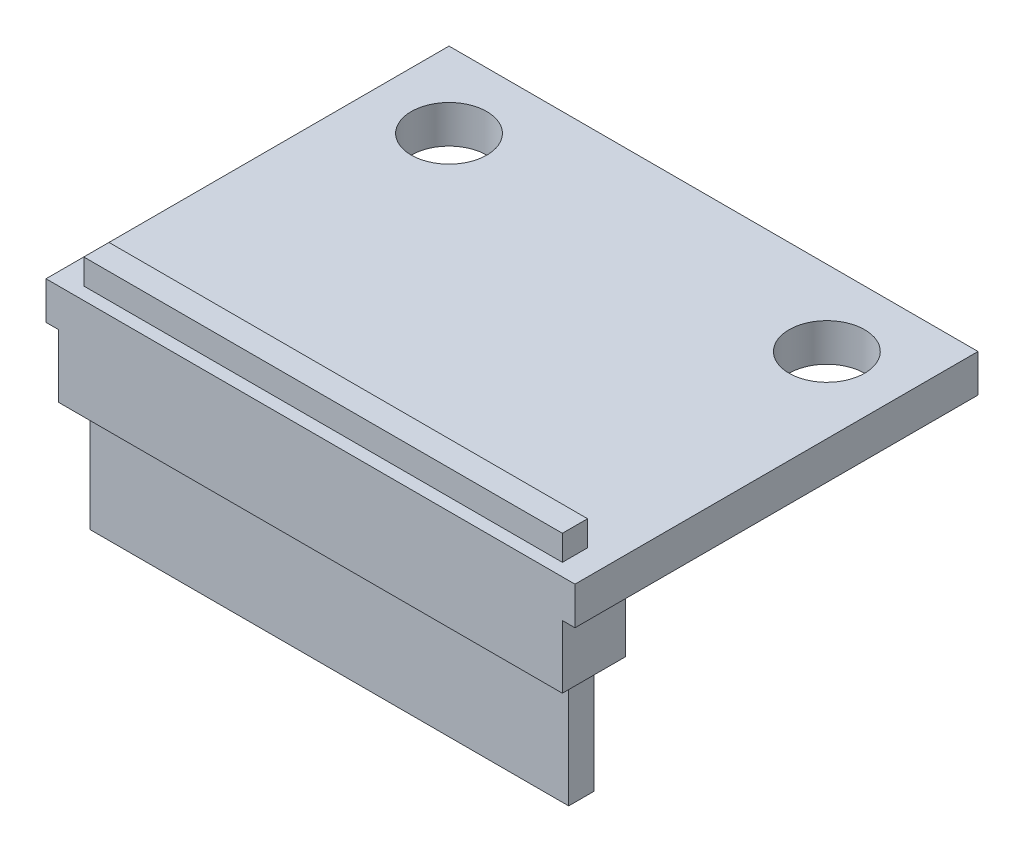
from build123d import *

# Parameters (mm, degrees)
SKETCH_1_W      = 21
SKETCH_1_H      = 16
SKETCH_1_R      = 1.5
EXTRUDE_2_DEPTH = 1.5
SKETCH_1_4_W    = 19
SKETCH_1_4_H    = 1
EXTRUDE_3_DEPTH = 1
SKETCH_3_W      = 19
SKETCH_3_H      = 1
EXTRUDE_4_DEPTH = 7
SKETCH_3_3_W    = 20
SKETCH_3_3_H    = 2.5
EXTRUDE_5_DEPTH = 2.5


with BuildPart() as part:
    # Эскиз1 → Бобышка-Вытянуть2 (new body)
    with BuildSketch(Plane(origin=(0, 0, 0), x_dir=(1, 0, 0), z_dir=(0, 1, 0))):
        Rectangle(SKETCH_1_W, SKETCH_1_H)
        with Locations((-7.5, 5)):
            Circle(SKETCH_1_R, mode=Mode.SUBTRACT)
        with Locations((7.5, 5)):
            Circle(SKETCH_1_R, mode=Mode.SUBTRACT)
    extrude(amount=-EXTRUDE_2_DEPTH)

    # Эскиз1<4> → Бобышка-Вытянуть3 (add)
    with BuildSketch(Plane(origin=(0, 0, 0), x_dir=(1, 0, 0), z_dir=(0, 1, 0))):
        with Locations((0, -7)):
            Rectangle(SKETCH_1_4_W, SKETCH_1_4_H)
    extrude(amount=EXTRUDE_3_DEPTH)

    # Эскиз3 → Бобышка-Вытянуть4 (add)
    with BuildSketch(Plane.XZ.offset(1.5)):
        with Locations((0, 6.75)):
            Rectangle(SKETCH_3_W, SKETCH_3_H)
    extrude(amount=EXTRUDE_4_DEPTH)

    # Эскиз3<3> → Бобышка-Вытянуть5 (add)
    with BuildSketch(Plane.XZ.offset(1.5)):
        with Locations((0, 6.75)):
            Rectangle(SKETCH_3_3_W, SKETCH_3_3_H)
    extrude(amount=EXTRUDE_5_DEPTH)


solid = part.part
